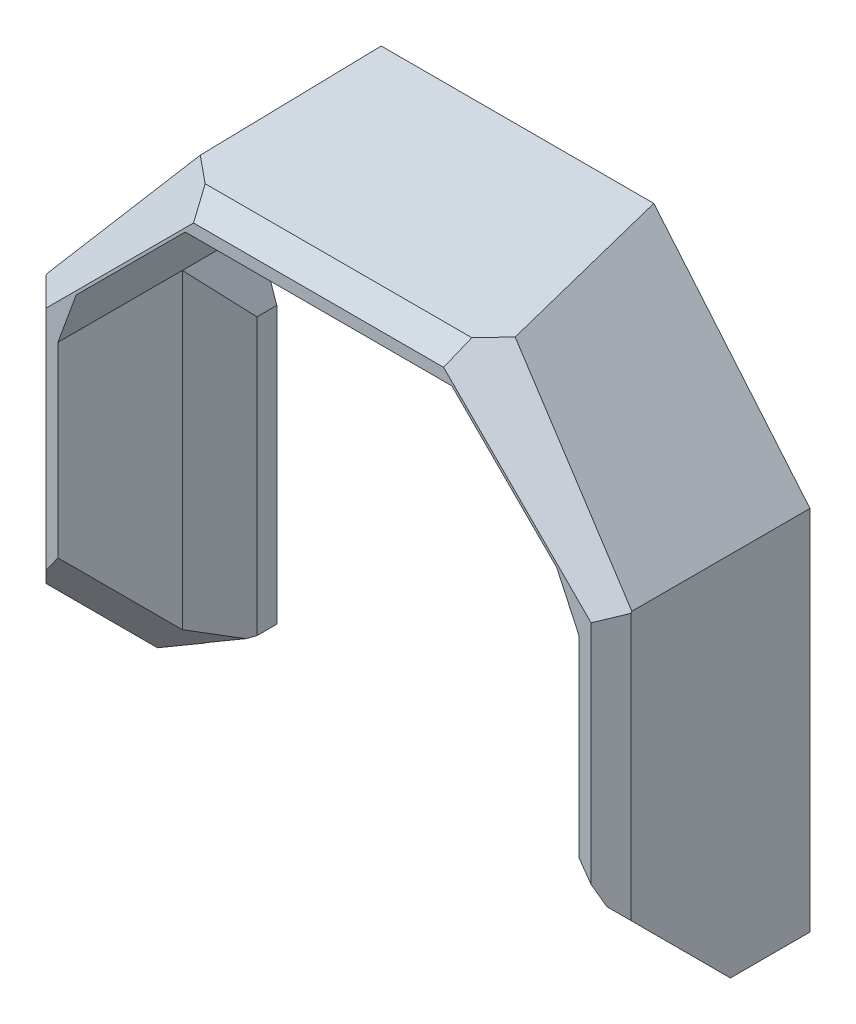
from build123d import *
from OCP.BRepFilletAPI import BRepFilletAPI_MakeChamfer

# Parameters (mm, degrees)
EXTRUDE_2_DEPTH     = 50
CHAMFER_1_SIZE      = 30
CHAMFER_2_SIZE      = 5
CHAMFER_3_SIZE      = 5
EXTRUDE_3_DEPTH     = 67
CHAMFER_6_SIZE      = 8
CHAMFER_6_SIZE2     = 6.474308837
CHAMFER_7_SIZE      = 59.001285691
CHAMFER_7_SIZE_2    = 8
CHAMFER_8_SIZE      = 59.001285691
CHAMFER_8_SIZE_2    = 8
EXTRUDE_4_DEPTH     = 5
CHAMFER_9_SIZE      = 13.737387097
CHAMFER_9_SIZE_2    = 5
SKETCH_5_R          = 1.1
CUT_EXTRUDE_1_DEPTH = 20


with BuildPart() as part:
    # Эскиз2 → Бобышка-Вытянуть2 (new body)
    with BuildSketch(Plane.XY):
        Polygon((-228.822789272, 61.401300251), (-228.822789272, 153.401300251), (-196.822789272, 185.401300251), (-129.822789272, 185.401300251), (-97.822789272, 153.401300251), (-97.822789272, 61.530932705), (-89.822789272, 61.530932705), (-89.822789272, 153.401300251), (-129.822789272, 193.401300251), (-196.822789272, 193.401300251), (-236.822789272, 153.401300251), (-236.822789272, 61.401300251), align=None)
    extrude(amount=EXTRUDE_2_DEPTH)

    # Фаска1
    chamfer_1_edges = [part.edges().sort_by_distance(p)[0] for p in [
        (-93.822789272, 61.530932705, 50),
        (-232.822789272, 61.401300251, 50),
    ]]
    chamfer(chamfer_1_edges, length=CHAMFER_1_SIZE)

    # Фаска2
    chamfer_2_edges = [part.edges().sort_by_distance(p)[0] for p in [
        (-109.822789272, 173.401300251, 50),
        (-89.822789272, 122.466116478, 50),
        (-163.322789272, 193.401300251, 50),
        (-216.822789272, 173.401300251, 50),
        (-236.822789272, 122.401300251, 50),
    ]]
    chamfer(chamfer_2_edges, length=CHAMFER_2_SIZE)

    # Фаска3
    chamfer_3_edges = [part.edges().sort_by_distance(p)[0] for p in [
        (-97.822789272, 76.530932705, 35),
        (-228.822789272, 76.401300251, 35),
    ]]
    chamfer(chamfer_3_edges, length=CHAMFER_3_SIZE)

    # Эскиз3 → Бобышка-Вытянуть3 (add)
    with BuildSketch(Plane(origin=(-129.822789272, 0, 0), x_dir=(0, 0, -1), z_dir=(1, 0, 0))):
        Polygon((-45, 193.401300251), (0, 193.401300251), (0, 200.504313431), align=None)
    extrude(amount=-EXTRUDE_3_DEPTH)

    # Фаска6: one chamfer whose edges measure the first distance from different faces: ONE call of the kernel's chamfer builder (chamfer() names one face for all edges)
    chamfer_6_edges_1 = [part.edges().sort_by_distance(p)[0] for p in [
        (-97.822789272, 153.401300251, 25),
    ]]
    chamfer_6_side_1 = [part.faces().sort_by_distance(p)[0] for p in [
        (-113.822789272, 169.401300251, 25),
    ]]
    chamfer_6_edges_2 = [part.edges().sort_by_distance(p)[0] for p in [
        (-228.822789272, 153.401300251, 25),
    ]]
    chamfer_6_side_2 = [part.faces().sort_by_distance(p)[0] for p in [
        (-228.822789272, 113.309285826, 22.779788417),
    ]]
    chamfer_6 = BRepFilletAPI_MakeChamfer(part.part.solid().wrapped)
    for e in chamfer_6_edges_1:
        chamfer_6.Add(CHAMFER_6_SIZE, CHAMFER_6_SIZE2, e.wrapped, chamfer_6_side_1[0].wrapped)  # the first distance lies on this face
    for e in chamfer_6_edges_2:
        chamfer_6.Add(CHAMFER_6_SIZE, CHAMFER_6_SIZE2, e.wrapped, chamfer_6_side_2[0].wrapped)  # the first distance lies on this face
    add(Compound.cast(chamfer_6.Shape()), mode=Mode.REPLACE)

    # Фаска7
    # the kernel refuses this chamfer: 59.001285691, 8 mm, written as the material it adds along each edge
    with BuildSketch(Plane(origin=(-196.822789272, 193.401300251, 0), x_dir=(-0.7047321498610482, -0.7094734645863968, 0), z_dir=(0, 0, 1))) as chamfer_7_piece_1_section:
        Polygon((CHAMFER_7_SIZE * 0.999994379973, -CHAMFER_7_SIZE * 0.00335261579405), (-CHAMFER_7_SIZE_2 * 0.709473464586, -CHAMFER_7_SIZE_2 * 0.704732149861), (0, 0), align=None)
    chamfer_7_piece_1 = extrude(amount=198.381753037, mode=Mode.PRIVATE)
    chamfer_7_piece_1 = split(chamfer_7_piece_1, bisect_by=Plane(origin=(-220.880283212, 186.62893037, 32.777571564), z_dir=(0.49999999999999994, -0.5, -0.7071067811865477)), keep=Keep.TOP, mode=Mode.PRIVATE)
    chamfer_7_piece_1 = split(chamfer_7_piece_1, bisect_by=Plane(origin=(-236.822789272, 178.689900101, 21.550087285), z_dir=(1, 0, 0)), keep=Keep.TOP, mode=Mode.PRIVATE)
    chamfer_7_piece_1 = split(chamfer_7_piece_1, bisect_by=Plane(origin=(-212.941252942, 196.655142254, 24.385806214), z_dir=(1.0444770759811184e-15, -0.9877705725829901, -0.1559143865686293)), keep=Keep.TOP, mode=Mode.PRIVATE)
    add(chamfer_7_piece_1)

    # Фаска8
    # the kernel refuses this chamfer: 59.001285691, 8 mm, written as the material it adds along each edge
    with BuildSketch(Plane(origin=(-129.822789272, 193.401300251, 0), x_dir=(0.7047321498610463, -0.7094734645863986, 0), z_dir=(0, 0, 1))) as chamfer_8_piece_1_section:
        Polygon((CHAMFER_8_SIZE * 0.999994379973, CHAMFER_8_SIZE * 0.00335261579405), (-CHAMFER_8_SIZE_2 * 0.709473464586, CHAMFER_8_SIZE_2 * 0.704732149861), (0, 0), align=None)
    chamfer_8_piece_1 = extrude(amount=198.381753037, mode=Mode.PRIVATE)
    chamfer_8_piece_1 = split(chamfer_8_piece_1, bisect_by=Plane(origin=(-89.822789272, 178.689900101, 21.550087285), z_dir=(-1, 0, 0)), keep=Keep.TOP, mode=Mode.PRIVATE)
    chamfer_8_piece_1 = split(chamfer_8_piece_1, bisect_by=Plane(origin=(-105.765295333, 186.62893037, 32.777571565), z_dir=(-0.5000000000000016, -0.4999999999999975, -0.7071067811865482)), keep=Keep.TOP, mode=Mode.PRIVATE)
    chamfer_8_piece_1 = split(chamfer_8_piece_1, bisect_by=Plane(origin=(-113.704325602, 196.655142254, 24.385806214), z_dir=(0, -0.9877705725829332, -0.15591438656898948)), keep=Keep.TOP, mode=Mode.PRIVATE)
    add(chamfer_8_piece_1)

    # Эскиз4 → Бобышка-Вытянуть4 (add)
    with BuildSketch(Plane(origin=(0, 0, 0), x_dir=(-1, 0, 0), z_dir=(0, 0, -1))):
        Polygon((97.822789272, 146.926991414), (102.822789272, 130.926991414), (102.822789272, 61.530932705), (97.822789272, 61.530932705), align=None)
        Polygon((228.822789272, 145.401300251), (228.822789272, 61.530932705), (223.822789272, 61.530932705), (223.822789272, 130.926991414), align=None)
    extrude(amount=-EXTRUDE_4_DEPTH)

    # Фаска9
    # the kernel refuses this chamfer: 13.737387097, 5 mm, written as the material it adds along each edge
    with BuildSketch(Plane(origin=(-97.822789272, 61.530932705, 5), x_dir=(0.013184058198649358, 0, 0.9999130865277315), z_dir=(0, 1, 0))) as chamfer_9_piece_1_section:
        Polygon((CHAMFER_9_SIZE * 0.999913086548, -CHAMFER_9_SIZE * 0.0131840581989), (-CHAMFER_9_SIZE_2 * 0.0131840581986, -CHAMFER_9_SIZE_2 * 0.999913086528), (0, 0), align=None)
    chamfer_9_piece_1 = extrude(amount=121.033515956, mode=Mode.PRIVATE)
    chamfer_9_piece_1 = split(chamfer_9_piece_1, bisect_by=Plane(origin=(-114.063470216, 91.772466116, 20.202674346), z_dir=(0.7071067811865477, 0.5, -0.4999999999999999)), keep=Keep.TOP, mode=Mode.PRIVATE)
    chamfer_9_piece_1 = split(chamfer_9_piece_1, bisect_by=Plane(origin=(-110.682470029, 105.776012992, 9.758348452), z_dir=(0.9544799780350295, -0.2982749931359476, 0)), keep=Keep.TOP, mode=Mode.PRIVATE)
    chamfer_9_piece_1 = split(chamfer_9_piece_1, bisect_by=Plane(origin=(-102.822789272, 102.21679201, 9.758348452), z_dir=(1, 0, 0)), keep=Keep.TOP, mode=Mode.PRIVATE)
    add(chamfer_9_piece_1)
    with BuildSketch(Plane(origin=(-228.822789272, 181.038757498, 5), x_dir=(0.9950833631817486, 0, -0.09904090225205033), z_dir=(0, -1, 0))) as chamfer_9_piece_2_section:
        Polygon((CHAMFER_9_SIZE_2 * 0.995083363182, CHAMFER_9_SIZE_2 * 0.0990409022521), (-CHAMFER_9_SIZE * 0.099040902254, CHAMFER_9_SIZE * 0.995083363202), (0, 0), align=None)
    chamfer_9_piece_2 = extrude(amount=119.507824793, mode=Mode.PRIVATE)
    chamfer_9_piece_2 = split(chamfer_9_piece_2, bisect_by=Plane(origin=(-199.458401516, 124.497296703, 34.497413224), z_dir=(-0.7071067811865471, 0.5000000000000006, -0.5000000000000001)), keep=Keep.TOP, mode=Mode.PRIVATE)
    chamfer_9_piece_2 = split(chamfer_9_piece_2, bisect_by=Plane(origin=(-228.851428884, 145.484207968, 13.577093316), z_dir=(-0.945194554128901, -0.32650766429759087, 0)), keep=Keep.TOP, mode=Mode.PRIVATE)
    chamfer_9_piece_2 = split(chamfer_9_piece_2, bisect_by=Plane(origin=(-223.822789272, 145.417616611, 13.577093316), z_dir=(-1, 0, 0)), keep=Keep.TOP, mode=Mode.PRIVATE)
    add(chamfer_9_piece_2)

    # Эскиз5 → Вырез-Вытянуть1 (cut)
    with BuildSketch(Plane(origin=(0, 0, 0), x_dir=(-1, 0, 0), z_dir=(0, 0, -1))):
        with Locations((96.322789272, 86.530932705)):
            Circle(SKETCH_5_R)
        with Locations((230.322789272, 86.530932705)):
            Circle(SKETCH_5_R)
        with Locations((163.322789272, 192.952806841)):
            Circle(SKETCH_5_R)
    extrude(amount=-CUT_EXTRUDE_1_DEPTH, mode=Mode.SUBTRACT)


solid = part.part
